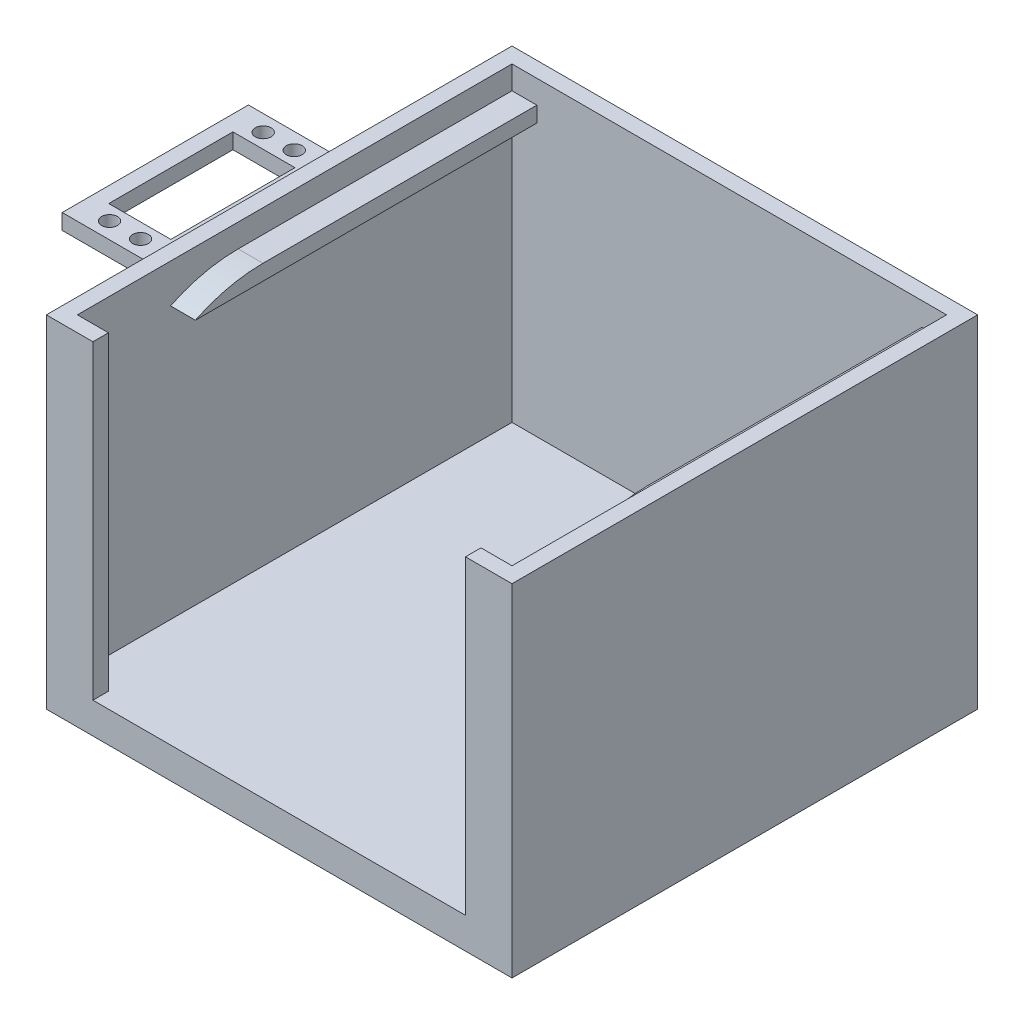
from build123d import *

# Parameters (mm, degrees)
SKETCH1_W           = 150
SKETCH1_H           = 150
BOSS_EXTRUDE1_DEPTH = 10
BOSS_EXTRUDE2_DEPTH = 100
BOSS_EXTRUDE3_DEPTH = 30
SKETCH9_R           = 2.55
SKETCH9_W           = 20
SKETCH9_H           = 40
CUT_EXTRUDE1_DEPTH  = 5
BOSS_EXTRUDE4_DEPTH = 25
SKETCH12_W          = 110
SKETCH12_H          = 5
BOSS_EXTRUDE5_DEPTH = 8
FILLET2_R           = 50
CUT_EXTRUDE3_DEPTH  = 8
BOSS_EXTRUDE6_DEPTH = 18
SKETCH15_W          = 150
SKETCH15_H          = 150
BOSS_EXTRUDE7_DEPTH = 5
SKETCH16_W          = 150
SKETCH16_H          = 23
CUT_EXTRUDE4_DEPTH  = 75


with BuildPart() as part:
    # Sketch1 → Boss-Extrude1 (new body)
    with BuildSketch(Plane(origin=(0, 0, 0), x_dir=(1, 0, 0), z_dir=(0, 1, 0))):
        Rectangle(SKETCH1_W, SKETCH1_H)
    extrude(amount=BOSS_EXTRUDE1_DEPTH)

    # Sketch2 → Boss-Extrude2 (add)
    with BuildSketch(Plane(origin=(0, 10, 0), x_dir=(1, 0, 0), z_dir=(0, 1, 0))):
        Polygon((-75, 75), (75, 75), (75, -75), (60, -75), (60, -70), (70, -70), (70, 70), (-70, 70), (-70, -70), (-60, -70), (-60, -75), (-75, -75), align=None)
    extrude(amount=BOSS_EXTRUDE2_DEPTH)

    # Sketch8 → Boss-Extrude3 (add)
    with BuildSketch(Plane.ZY.offset(75)):
        Polygon((9.9, 106), (39.9, 106), (39.9, 101), (-20.1, 101), (-20.1, 106), align=None)
    extrude(amount=BOSS_EXTRUDE3_DEPTH)

    # Sketch9 → Cut-Extrude1 (cut)
    with BuildSketch(Plane(origin=(0, 106, 0), x_dir=(1, 0, 0), z_dir=(0, 1, 0))):
        with Locations(Location((-95, 14.85, 0), (0, 0, 270))):
            Circle(SKETCH9_R)
        with Locations(Location((-85, 14.85, 0), (0, 0, 90))):
            Circle(SKETCH9_R)
        with Locations(Location((-85, -34.65, 0), (0, 0, 270))):
            Circle(SKETCH9_R)
        with Locations(Location((-95, -34.65, 0), (0, 0, 90))):
            Circle(SKETCH9_R)
        with Locations((-90, -9.9)):
            Rectangle(SKETCH9_W, SKETCH9_H)
    extrude(amount=-CUT_EXTRUDE1_DEPTH, mode=Mode.SUBTRACT)

    # Sketch10 → Boss-Extrude4 (add)
    with BuildSketch(Plane.ZY.offset(75)):
        Polygon((-10.1, 77.3), (-10.1, 72.3), (7.4, 72.3), (7.4, 52.3), (12.4, 52.3), (12.4, 72.3), (29.9, 72.3), (29.9, 77.3), align=None)
    extrude(amount=BOSS_EXTRUDE4_DEPTH)

    # Sketch12 → Boss-Extrude5 (add)
    with BuildSketch(Plane(origin=(-70, 0, 0), x_dir=(0, 0, -1), z_dir=(1, 0, 0))):
        with Locations((15, 100)):
            Rectangle(SKETCH12_W, SKETCH12_H)
    boss_extrude5 = extrude(amount=BOSS_EXTRUDE5_DEPTH)

    # Mirror1: Boss-Extrude5 across plane
    add(boss_extrude5.mirror(Plane(origin=(0, 0, 0), x_dir=(0, 0, 1), z_dir=(1, 0, 0))))

    # Fillet2
    # the kernel refuses this fillet: 50 mm, written as the material it takes off along each edge
    with BuildSketch(Plane(origin=(70, 102.5, 40), x_dir=(0, -1, 0), z_dir=(-1, 0, 0))) as fillet2_piece_1:
        with BuildLine():
            CenterArc((50, -21.794494718), FILLET2_R, 154.158067237, 25.841932763)
            Line((0, -21.794494718), (0, 0))
            Line((0, 0), (5, 0))
        make_face()
    extrude(amount=62.486236794, mode=Mode.SUBTRACT)
    with BuildSketch(Plane(origin=(-70, 102.5, 40), x_dir=(0, 0, -1), z_dir=(1, 0, 0))) as fillet2_piece_2:
        with BuildLine():
            CenterArc((21.794494718, -50), FILLET2_R, 90, 25.841932763)
            Line((0, -5), (0, 0))
            Line((0, 0), (21.794494718, 0))
        make_face()
    extrude(amount=62.486236794, mode=Mode.SUBTRACT)

    # Sketch13 → Cut-Extrude3 (cut)
    with BuildSketch(Plane.XY.offset(12.4)):
        Polygon((-100, 52.3), (-100, 70.3), (-80, 52.3), align=None)
    extrude(amount=-CUT_EXTRUDE3_DEPTH, mode=Mode.SUBTRACT)

    # Sketch14 → Boss-Extrude6 (add)
    with BuildSketch(Plane(origin=(0, 110, 0), x_dir=(1, 0, 0), z_dir=(0, 1, 0))):
        Polygon((-75, -75), (-60, -75), (-60, -70), (-70, -70), (-70, -35), (-75, -35), align=None)
        Polygon((60, -75), (60, -70), (70, -70), (70, 70), (-70, 70), (-70, 65), (-75, 65), (-75, 75), (75, 75), (75, -75), align=None)
    extrude(amount=BOSS_EXTRUDE6_DEPTH)

    # Sketch15 → Boss-Extrude7 (add)
    with BuildSketch(Plane(origin=(0, 128, 0), x_dir=(1, 0, 0), z_dir=(0, 1, 0))):
        Rectangle(SKETCH15_W, SKETCH15_H)
    extrude(amount=BOSS_EXTRUDE7_DEPTH)

    # Sketch16 → Cut-Extrude4 (cut, symmetric)
    with BuildSketch(Plane.XY):
        with Locations((0, 121.5)):
            Rectangle(SKETCH16_W, SKETCH16_H)
    extrude(amount=CUT_EXTRUDE4_DEPTH, both=True, mode=Mode.SUBTRACT)


solid = part.part
